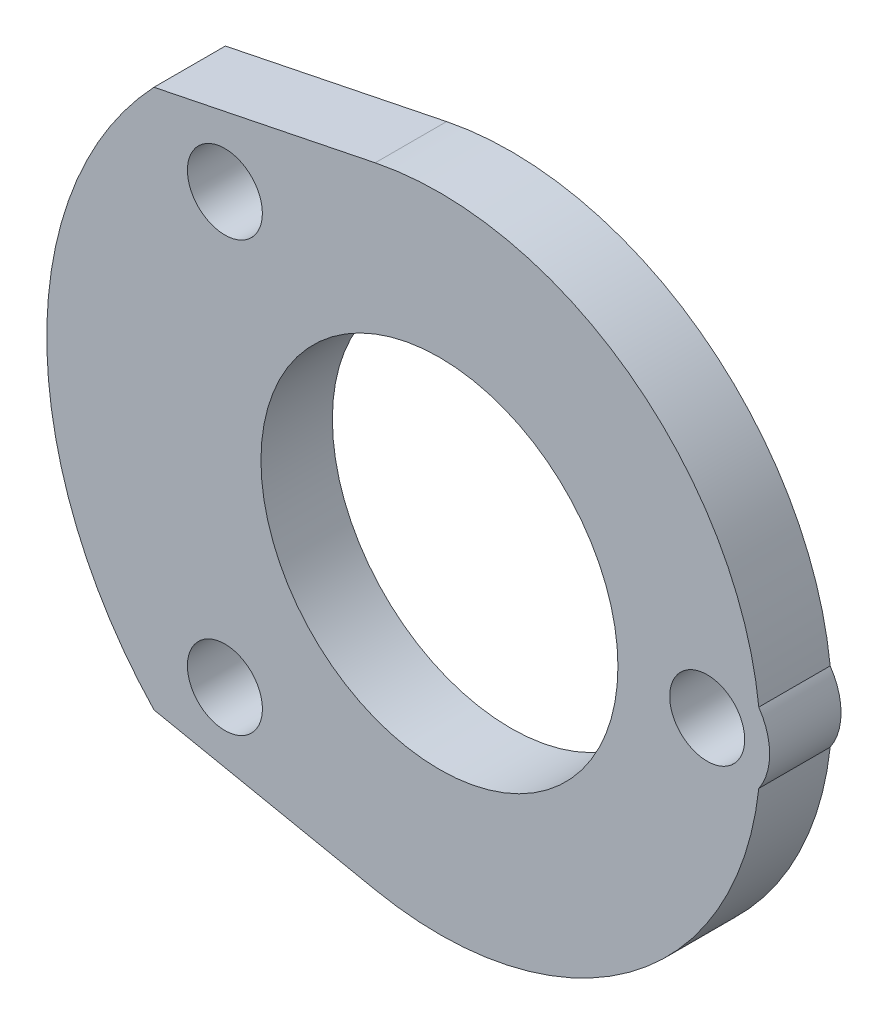
from build123d import *

# Parameters (mm, degrees)
ESQUISSE1_R        = 5
ESQUISSE1_R_2      = 1.05
BOSS_EXTRU_1_DEPTH = 2


with BuildPart() as part:
    # Esquisse1 → Boss.-Extru.1 (new body)
    with BuildSketch(Plane.XY):
        with BuildLine():
            Line((-7.996773354, 7.55325201), (-1.8, 8.818163074))
            ThreePointArc((-1.8, 8.818163074), (5.30110237, 7.27312269), (8.945833333, 0.985934061))
            ThreePointArc((8.945833333, 0.985934061), (9.25, 0), (8.945833333, -0.985934061))
            ThreePointArc((8.945833333, -0.985934061), (5.30110237, -7.27312269), (-1.8, -8.818163074))
            Line((-1.8, -8.818163074), (-7.996773354, -7.55325201))
            ThreePointArc((-7.996773354, -7.55325201), (-11, 0), (-7.996773354, 7.55325201))
        make_face()
        Circle(ESQUISSE1_R, mode=Mode.SUBTRACT)
        with Locations((7.5, 0)):
            Circle(ESQUISSE1_R_2, mode=Mode.SUBTRACT)
        with Locations((-6.01040764, 6.01040764)):
            Circle(ESQUISSE1_R_2, mode=Mode.SUBTRACT)
        with Locations((-6.01040764, -6.01040764)):
            Circle(ESQUISSE1_R_2, mode=Mode.SUBTRACT)
    extrude(amount=BOSS_EXTRU_1_DEPTH)


solid = part.part
